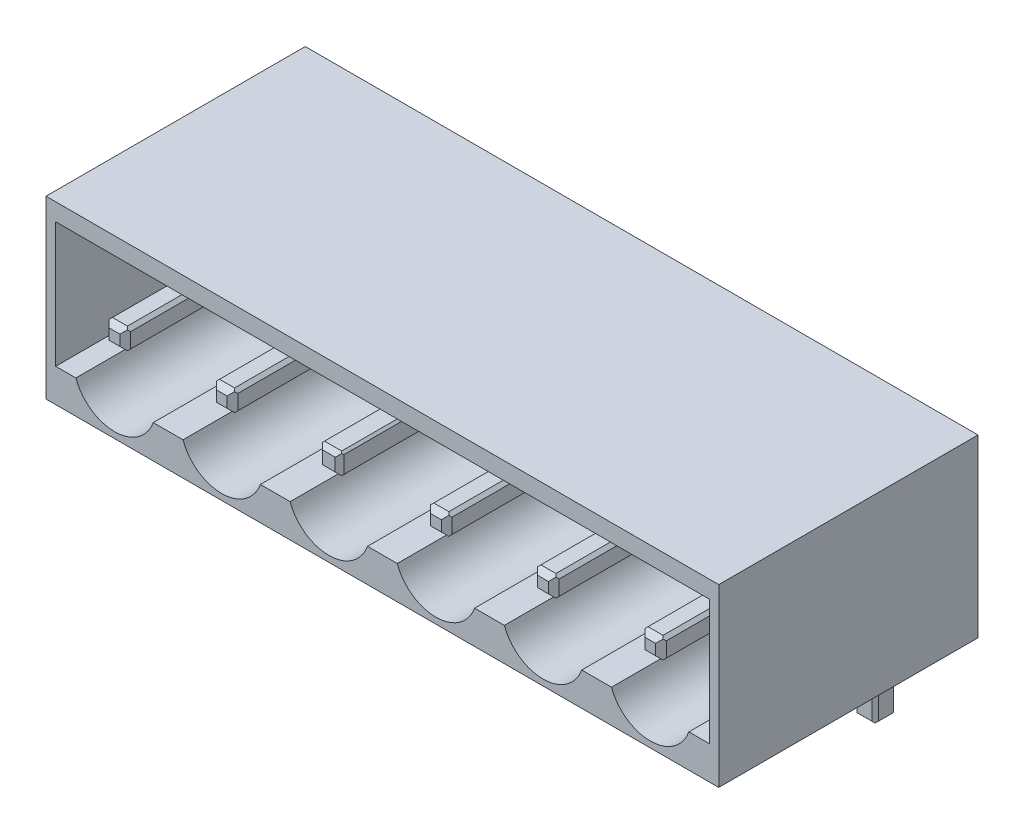
from build123d import *

# Parameters (mm, degrees)
SKETCH_1_W          = 31.4
SKETCH_1_H          = 8.2
EXTRUDE_1_DEPTH     = 12.1
SKETCH_4_R          = 1.25
CUT_EXTRUDE_3_DEPTH = 8
CUT_EXTRUDE_4_DEPTH = 7.8
SKETCH_7_W          = 1
SKETCH_7_H          = 1
EXTRUDE_2_DEPTH     = 8
CHAMFER_1_SIZE      = 0.15
CHAMFER_2_SIZE      = 0.25
SKETCH_8_W          = 1
SKETCH_8_H          = 1
EXTRUDE_3_DEPTH     = 4
CHAMFER_3_SIZE      = 0.15
CHAMFER_4_SIZE      = 0.25
CHAMFER_6_SIZE      = 0.1
CHAMFER_7_SIZE      = 0.2
CHAMFER_8_SIZE      = 0.1
CHAMFER_9_SIZE      = 0.2


with BuildPart() as part:
    # Эскиз1 → Бобышка-Вытянуть1 (new body)
    with BuildSketch(Plane.XY):
        Rectangle(SKETCH_1_W, SKETCH_1_H)
    extrude(amount=EXTRUDE_1_DEPTH)

    # Эскиз4 → Вырез-Вытянуть3 (cut)
    with BuildSketch(Plane.XY.offset(12.1)):
        with Locations((-12.5, 0)):
            Circle(SKETCH_4_R)
        with Locations((-7.5, 0)):
            Circle(SKETCH_4_R)
        with Locations((-2.5, 0)):
            Circle(SKETCH_4_R)
        with Locations((2.5, 0)):
            Circle(SKETCH_4_R)
        with Locations((7.5, 0)):
            Circle(SKETCH_4_R)
        with Locations((12.5, 0)):
            Circle(SKETCH_4_R)
    extrude(amount=-CUT_EXTRUDE_3_DEPTH, mode=Mode.SUBTRACT)

    # Эскиз5 → Вырез-Вытянуть4 (cut)
    with BuildSketch(Plane.XY.offset(12.1)):
        with BuildLine():
            Line((-15.245621634, 0), (-15.245621634, 3.292901982))
            Line((-15.245621634, 3.292901982), (-4.721490456, 3.292901982))
            Line((-4.721490456, 3.292901982), (0.278509544, 3.292901982))
            Line((0.278509544, 3.292901982), (5.278509544, 3.292901982))
            Line((5.278509544, 3.292901982), (15.278509544, 3.292901982))
            Line((15.278509544, 3.292901982), (15.278509544, -2.548957219))
            Line((15.278509544, -2.548957219), (14.30582632, -2.548957219))
            ThreePointArc((14.30582632, -2.548957219), (12.5, -3.818893996), (10.69417368, -2.548957219))
            Line((10.69417368, -2.548957219), (9.30582632, -2.548957219))
            ThreePointArc((9.30582632, -2.548957219), (7.5, -3.818893996), (5.69417368, -2.548957219))
            Line((5.69417368, -2.548957219), (4.30582632, -2.548957219))
            ThreePointArc((4.30582632, -2.548957219), (2.5, -3.818893996), (0.69417368, -2.548957219))
            Line((0.69417368, -2.548957219), (-0.69417368, -2.548957219))
            ThreePointArc((-0.69417368, -2.548957219), (-2.5, -3.818893996), (-4.30582632, -2.548957219))
            Line((-4.30582632, -2.548957219), (-5.69417368, -2.548957219))
            ThreePointArc((-5.69417368, -2.548957219), (-7.5, -3.818893996), (-9.30582632, -2.548957219))
            Line((-9.30582632, -2.548957219), (-10.69417368, -2.548957219))
            ThreePointArc((-10.69417368, -2.548957219), (-12.5, -3.818893996), (-14.30582632, -2.548957219))
            Line((-14.30582632, -2.548957219), (-15.245621634, -2.548957219))
            Line((-15.245621634, -2.548957219), (-15.245621634, 0))
        make_face()
    extrude(amount=-CUT_EXTRUDE_4_DEPTH, mode=Mode.SUBTRACT)

    # Эскиз7 → Бобышка-Вытянуть2 (add)
    with BuildSketch(Plane.XY.offset(4.1)):
        with Locations((-7.5, 0)):
            Rectangle(SKETCH_7_W, SKETCH_7_H)
        with Locations((-12.5, 0)):
            Rectangle(SKETCH_7_W, SKETCH_7_H)
        with Locations((-2.5, 0)):
            Rectangle(SKETCH_7_W, SKETCH_7_H)
        with Locations((2.5, 0)):
            Rectangle(SKETCH_7_W, SKETCH_7_H)
        with Locations((7.5, 0)):
            Rectangle(SKETCH_7_W, SKETCH_7_H)
        with Locations((12.5, 0)):
            Rectangle(SKETCH_7_W, SKETCH_7_H)
    extrude(amount=EXTRUDE_2_DEPTH)

    # Фаска1
    chamfer_1_edges = [part.edges().sort_by_distance(p)[0] for p in [
        (-12, -0.5, 8.1),
        (-12, 0.5, 8.1),
        (-13, 0.5, 8.1),
        (-13, -0.5, 8.1),
        (-7, -0.5, 8.1),
        (-7, 0.5, 8.1),
        (-8, 0.5, 8.1),
        (-8, -0.5, 8.1),
        (8, -0.5, 8.1),
        (8, 0.5, 8.1),
        (7, 0.5, 8.1),
        (7, -0.5, 8.1),
        (13, -0.5, 8.1),
        (13, 0.5, 8.1),
        (12, 0.5, 8.1),
        (12, -0.5, 8.1),
    ]]
    chamfer(chamfer_1_edges, length=CHAMFER_1_SIZE)

    # Фаска2
    # the kernel refuses this chamfer: 0.25 mm, written as the material it takes off along each edge
    with BuildSketch(Plane(origin=(-8, -0.992920747, 12.1), x_dir=(-0.027495876610589005, 0, -0.9996219169112968), z_dir=(0, 1, 0)), Plane(origin=(-8.492920747, 0.5, 12.1), x_dir=(0, 0.027495876610586414, -0.9996219169112968), z_dir=(1, 0, 0)), Plane(origin=(-7, 0.992920747, 12.1), x_dir=(0.02749587661058555, 0, -0.9996219169112968), z_dir=(0, -1, 0)), Plane(origin=(-6.507079253, -0.5, 12.1), x_dir=(0, -0.027495876610586414, -0.9996219169112968), z_dir=(-1, 0, 0)), Plane(origin=(-12, 0.992920747, 12.1), x_dir=(0.027495876610589005, 0, -0.9996219169112968), z_dir=(0, -1, 0)), Plane(origin=(-11.507079253, -0.5, 12.1), x_dir=(0, -0.027495876610586414, -0.9996219169112968), z_dir=(-1, 0, 0)), Plane(origin=(-13, -0.992920747, 12.1), x_dir=(-0.027495876610589005, 0, -0.9996219169112968), z_dir=(0, 1, 0)), Plane(origin=(-13.492920747, 0.5, 12.1), x_dir=(0, 0.027495876610586414, -0.9996219169112968), z_dir=(1, 0, 0)), Plane(origin=(13, 0.992920747, 12.1), x_dir=(0.027495876610589005, 0, -0.9996219169112968), z_dir=(0, -1, 0)), Plane(origin=(13.492920747, -0.5, 12.1), x_dir=(0, -0.027495876610586414, -0.9996219169112968), z_dir=(-1, 0, 0)), Plane(origin=(11.507079253, 0.5, 12.1), x_dir=(0, 0.027495876610586414, -0.9996219169112968), z_dir=(1, 0, 0)), Plane(origin=(12, -0.992920747, 12.1), x_dir=(-0.027495876610589005, 0, -0.9996219169112968), z_dir=(0, 1, 0)), Plane(origin=(8, 0.992920747, 12.1), x_dir=(0.027495876610589005, 0, -0.9996219169112968), z_dir=(0, -1, 0)), Plane(origin=(8.492920747, -0.5, 12.1), x_dir=(0, -0.027495876610586414, -0.9996219169112968), z_dir=(-1, 0, 0)), Plane(origin=(7, -0.992920747, 12.1), x_dir=(-0.02749587661058555, 0, -0.9996219169112968), z_dir=(0, 1, 0)), Plane(origin=(6.507079253, 0.5, 12.1), x_dir=(0, 0.027495876610586414, -0.9996219169112968), z_dir=(1, 0, 0))) as chamfer_2_piece_1:
        Polygon((CHAMFER_2_SIZE * 0.999621916911, -CHAMFER_2_SIZE * 0.0274958766106), (-CHAMFER_2_SIZE * 0.0274958766106, -CHAMFER_2_SIZE * 0.999621916911), (0, 0), align=None)
    extrude(amount=1.985841494, mode=Mode.SUBTRACT)

    # Эскиз8 → Бобышка-Вытянуть3 (add)
    with BuildSketch(Plane(origin=(0, -4.1, 0), x_dir=(-1, 0, 0), z_dir=(0, -1, 0))):
        with Locations((7.5, -1.6)):
            Rectangle(SKETCH_8_W, SKETCH_8_H)
        with Locations((12.5, -1.6)):
            Rectangle(SKETCH_8_W, SKETCH_8_H)
        with Locations((2.5, -1.6)):
            Rectangle(SKETCH_8_W, SKETCH_8_H)
        with Locations((-2.5, -1.6)):
            Rectangle(SKETCH_8_W, SKETCH_8_H)
        with Locations((-7.5, -1.6)):
            Rectangle(SKETCH_8_W, SKETCH_8_H)
        with Locations((-12.5, -1.6)):
            Rectangle(SKETCH_8_W, SKETCH_8_H)
    extrude(amount=EXTRUDE_3_DEPTH)

    # Фаска3
    chamfer_3_edges = [part.edges().sort_by_distance(p)[0] for p in [
        (3, -0.5, 8.1),
        (3, 0.5, 8.1),
        (2, 0.5, 8.1),
        (2, -0.5, 8.1),
        (-12, -6.1, 1.1),
        (-12, -6.1, 2.1),
        (-13, -6.1, 2.1),
        (-13, -6.1, 1.1),
        (-7, -6.1, 1.1),
        (-7, -6.1, 2.1),
        (-8, -6.1, 2.1),
        (-8, -6.1, 1.1),
        (3, -6.1, 1.1),
        (3, -6.1, 2.1),
        (2, -6.1, 2.1),
        (2, -6.1, 1.1),
        (8, -6.1, 1.1),
        (8, -6.1, 2.1),
        (7, -6.1, 2.1),
        (7, -6.1, 1.1),
        (13, -6.1, 1.1),
        (13, -6.1, 2.1),
        (12, -6.1, 2.1),
        (12, -6.1, 1.1),
    ]]
    chamfer(chamfer_3_edges, length=CHAMFER_3_SIZE)

    # Фаска4
    # the kernel refuses this chamfer: 0.25 mm, written as the material it takes off along each edge
    with BuildSketch(Plane(origin=(-7, -8.1, 2.592920747), x_dir=(0.027495876610585647, 0.9996219169112968, 0), z_dir=(0, 0, -1)), Plane(origin=(-8, -8.1, 0.607079253), x_dir=(-0.0274958766105891, 0.9996219169112968, 0), z_dir=(0, 0, 1)), Plane(origin=(-8.492920747, -8.1, 2.1), x_dir=(0, 0.9996219169112968, 0.027495876610585647), z_dir=(1, 0, 0)), Plane(origin=(-6.507079253, -8.1, 1.1), x_dir=(0, 0.9996219169112968, -0.02749587661058651), z_dir=(-1, 0, 0)), Plane(origin=(-13, -8.1, 0.607079253), x_dir=(-0.0274958766105891, 0.9996219169112968, 0), z_dir=(0, 0, 1)), Plane(origin=(-13.492920747, -8.1, 2.1), x_dir=(0, 0.9996219169112968, 0.027495876610585647), z_dir=(1, 0, 0)), Plane(origin=(-12, -8.1, 2.592920747), x_dir=(0.0274958766105891, 0.9996219169112968, 0), z_dir=(0, 0, -1)), Plane(origin=(-11.507079253, -8.1, 1.1), x_dir=(0, 0.9996219169112968, -0.02749587661058651), z_dir=(-1, 0, 0)), Plane(origin=(3.492920747, -8.1, 1.1), x_dir=(0, 0.9996219169112968, -0.02749587661058651), z_dir=(-1, 0, 0)), Plane(origin=(2, -8.1, 0.607079253), x_dir=(-0.02749587661058651, 0.9996219169112968, 0), z_dir=(0, 0, 1)), Plane(origin=(1.507079253, -8.1, 2.1), x_dir=(0, 0.9996219169112968, 0.027495876610585647), z_dir=(1, 0, 0)), Plane(origin=(3, -8.1, 2.592920747), x_dir=(0.027495876610585647, 0.9996219169112968, 0), z_dir=(0, 0, -1)), Plane(origin=(3.492920747, -0.5, 12.1), x_dir=(0, -0.027495876610586414, -0.9996219169112968), z_dir=(-1, 0, 0)), Plane(origin=(2, -0.992920747, 12.1), x_dir=(-0.027495876610586414, 0, -0.9996219169112968), z_dir=(0, 1, 0)), Plane(origin=(3, 0.992920747, 12.1), x_dir=(0.02749587661058555, 0, -0.9996219169112968), z_dir=(0, -1, 0)), Plane(origin=(1.507079253, 0.5, 12.1), x_dir=(0, 0.027495876610586414, -0.9996219169112968), z_dir=(1, 0, 0)), Plane(origin=(12, -8.1, 0.607079253), x_dir=(-0.0274958766105891, 0.9996219169112968, 0), z_dir=(0, 0, 1)), Plane(origin=(13.492920747, -8.1, 1.1), x_dir=(0, 0.9996219169112968, -0.02749587661058651), z_dir=(-1, 0, 0)), Plane(origin=(13, -8.1, 2.592920747), x_dir=(0.0274958766105891, 0.9996219169112968, 0), z_dir=(0, 0, -1)), Plane(origin=(11.507079253, -8.1, 2.1), x_dir=(0, 0.9996219169112968, 0.027495876610585647), z_dir=(1, 0, 0)), Plane(origin=(8, -8.1, 2.592920747), x_dir=(0.0274958766105891, 0.9996219169112968, 0), z_dir=(0, 0, -1)), Plane(origin=(8.492920747, -8.1, 1.1), x_dir=(0, 0.9996219169112968, -0.02749587661058651), z_dir=(-1, 0, 0)), Plane(origin=(7, -8.1, 0.607079253), x_dir=(-0.027495876610585647, 0.9996219169112968, 0), z_dir=(0, 0, 1)), Plane(origin=(6.507079253, -8.1, 2.1), x_dir=(0, 0.9996219169112968, 0.027495876610585647), z_dir=(1, 0, 0))) as chamfer_4_piece_1:
        Polygon((CHAMFER_4_SIZE * 0.999621916911, -CHAMFER_4_SIZE * 0.0274958766106), (-CHAMFER_4_SIZE * 0.0274958766106, -CHAMFER_4_SIZE * 0.999621916911), (0, 0), align=None)
    extrude(amount=1.985841494, mode=Mode.SUBTRACT)

    # Фаска6
    chamfer_6_edges = [part.edges().sort_by_distance(p)[0] for p in [
        (-2, -0.5, 8.1),
        (-2, 0.5, 8.1),
        (-3, 0.5, 8.1),
        (-3, -0.5, 8.1),
    ]]
    chamfer(chamfer_6_edges, length=CHAMFER_6_SIZE)

    # Фаска7
    # the kernel refuses this chamfer: 0.2 mm, written as the material it takes off along each edge
    with BuildSketch(Plane(origin=(-2, 0.914336598, 12.1), x_dir=(0.02749587661058634, 0, -0.9996219169112966), z_dir=(0, -1, 0)), Plane(origin=(-1.585663402, -0.5, 12.1), x_dir=(0, -0.02749587661058634, -0.9996219169112966), z_dir=(-1, 0, 0)), Plane(origin=(-3, -0.914336598, 12.1), x_dir=(-0.02749587661058742, 0, -0.9996219169112966), z_dir=(0, 1, 0)), Plane(origin=(-3.414336598, 0.5, 12.1), x_dir=(0, 0.02749587661058634, -0.9996219169112966), z_dir=(1, 0, 0))) as chamfer_7_piece_1:
        Polygon((CHAMFER_7_SIZE * 0.999621916911, -CHAMFER_7_SIZE * 0.0274958766106), (-CHAMFER_7_SIZE * 0.0274958766106, -CHAMFER_7_SIZE * 0.999621916911), (0, 0), align=None)
    extrude(amount=1.828673195, mode=Mode.SUBTRACT)

    # Фаска8
    chamfer_8_edges = [part.edges().sort_by_distance(p)[0] for p in [
        (-2, -6.1, 1.1),
        (-2, -6.1, 2.1),
        (-3, -6.1, 2.1),
        (-3, -6.1, 1.1),
    ]]
    chamfer(chamfer_8_edges, length=CHAMFER_8_SIZE)

    # Фаска9
    # the kernel refuses this chamfer: 0.2 mm, written as the material it takes off along each edge
    with BuildSketch(Plane(origin=(-2, -8.1, 2.514336598), x_dir=(0.027495876610586223, 0.9996219169112966, 0), z_dir=(0, 0, -1)), Plane(origin=(-1.585663402, -8.1, 1.1), x_dir=(0, 0.9996219169112968, -0.027495876610586226), z_dir=(-1, 0, 0)), Plane(origin=(-3, -8.1, 0.685663402), x_dir=(-0.027495876610587302, 0.9996219169112966, 0), z_dir=(0, 0, 1)), Plane(origin=(-3.414336598, -8.1, 2.1), x_dir=(0, 0.9996219169112966, 0.027495876610587302), z_dir=(1, 0, 0))) as chamfer_9_piece_1:
        Polygon((CHAMFER_9_SIZE * 0.999621916911, -CHAMFER_9_SIZE * 0.0274958766106), (-CHAMFER_9_SIZE * 0.0274958766106, -CHAMFER_9_SIZE * 0.999621916911), (0, 0), align=None)
    extrude(amount=1.828673195, mode=Mode.SUBTRACT)


solid = part.part
